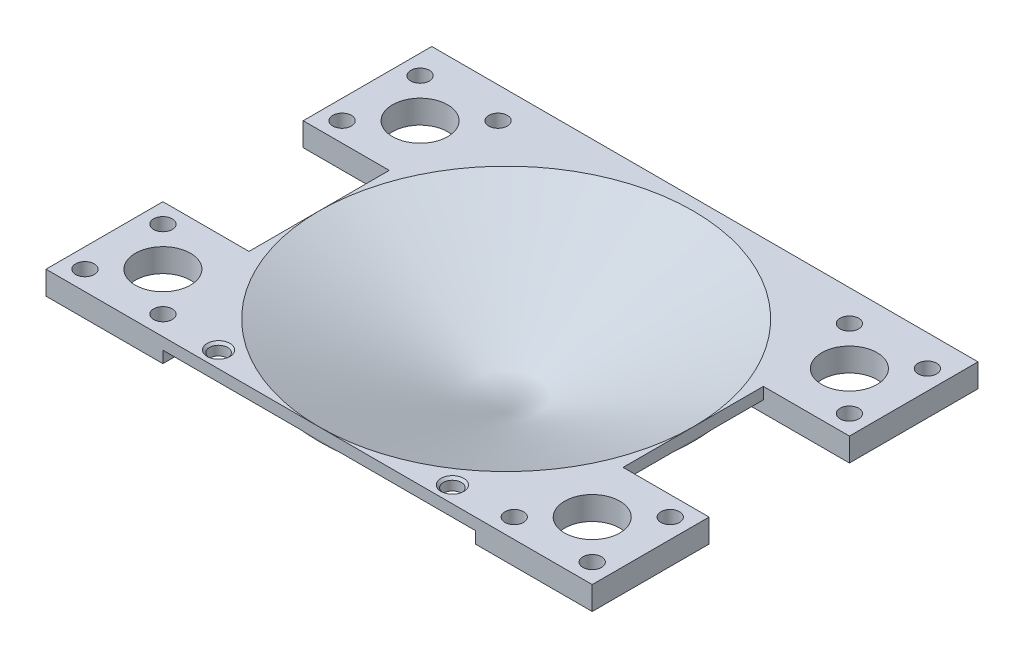
from build123d import *

# Parameters (mm, degrees)
BOSS_EXTRUDE1_START                  = -3.175
BOSS_EXTRUDE1_DEPTH                  = 3.175
SKETCH4_W                            = 31.75
SKETCH4_H                            = 31.75
SKETCH4_R                            = 7.5
BOSS_EXTRUDE2_DEPTH                  = 6.35
CUT_EXTRUDE1_REACH                   = 95.422
F_8_0_199_DIAMETER_HOLE1_D           = 5.0546
F_8_0_199_DIAMETER_HOLE1_CSINK_D     = 6.3246
F_8_0_199_DIAMETER_HOLE1_CSINK_ANGLE = 90
MIRROR4_COPY_1_SKETCH_W              = 31.75
MIRROR4_COPY_1_SKETCH_H              = 31.75
MIRROR4_COPY_1_SKETCH_R              = 7.5
MIRROR4_COPY_1_DEPTH                 = 6.35
MIRROR4_COPY_2_REACH                 = 95.422
MIRROR4_COPY_3_D                     = 5.0546
MIRROR4_COPY_3_CSINK_D               = 6.3246
MIRROR4_COPY_3_CSINK_ANGLE           = 90
BOSS_EXTRUDE5_DEPTH                  = 3.175
F_8_CLEARANCE_HOLE1_D                = 4.9149
F_8_CLEARANCE_HOLE1_CSINK_D          = 6.1849
F_8_CLEARANCE_HOLE1_CSINK_ANGLE      = 90


with BuildPart() as part:
    # Sketch1 → Revolve1 (revolve)
    with BuildSketch(Plane.XY):
        Polygon((0, -21.941501914), (-50.8, 0), (-50.8, -3.458498086), (0, -25.4), align=None)
    revolve(axis=Axis((0, -55, 0), (0, 1, 0)))

    # Sketch3 → Boss-Extrude1 (add)
    with BuildSketch(Plane(origin=(0, 0, 0), x_dir=(1, 0, 0), z_dir=(0, 1, 0)).offset(BOSS_EXTRUDE1_START)):
        with BuildLine():
            Line((-50.8, 8e-09), (-50.8, -50.8))
            Line((-50.8, -50.8), (0, -50.8))
            ThreePointArc((0, -50.8), (-35.921024487, -35.921024482), (-50.8, 8e-09))
        make_face()
        with BuildLine():
            ThreePointArc((50.8, 0), (35.921024484, -35.921024484), (0, -50.8))
            Line((0, -50.8), (50.8, -50.8))
            Line((50.8, -50.8), (50.8, 0))
        make_face()
        with BuildLine():
            Line((-50.8, 50.8), (-50.8, 8e-09))
            ThreePointArc((-50.8, 8e-09), (-35.921024463, 35.921024505), (5.1e-08, 50.8))
            Line((5.1e-08, 50.8), (-50.8, 50.8))
        make_face()
        with BuildLine():
            ThreePointArc((5.1e-08, 50.8), (35.921024502, 35.921024466), (50.8, 0))
            Line((50.8, 0), (50.8, 50.8))
            Line((50.8, 50.8), (5.1e-08, 50.8))
        make_face()
    extrude(amount=BOSS_EXTRUDE1_DEPTH)

    # Sketch4 → Boss-Extrude2 (add)
    with BuildSketch(Plane(origin=(0, 0, 0), x_dir=(1, 0, 0), z_dir=(0, 1, 0))):
        with Locations((-58.3, -34.925)):
            Rectangle(SKETCH4_W, SKETCH4_H)
        with Locations((-58.3, -34.925)):
            Circle(SKETCH4_R, mode=Mode.SUBTRACT)
    boss_extrude2 = extrude(amount=-BOSS_EXTRUDE2_DEPTH)

    # Cut-Extrude1: up to this cone (the profile starts inside it)
    cut_extrude1_end = Plane(origin=(0, 0, 0), z_dir=(0, 1, 0)).offset(-21.941500914) * Cone(2.315e-06, 390.497693855, 168.663500914, align=(Align.CENTER, Align.CENTER, Align.MIN), mode=Mode.PRIVATE)
    # Sketch4<4> → Cut-Extrude1 (cut, up to the surface)
    with BuildSketch(Plane(origin=(0, 0, 0), x_dir=(1, 0, 0), z_dir=(0, 1, 0)), mode=Mode.PRIVATE) as cut_extrude1_sk1:
        with BuildLine():
            Line((-42.425, -19.05), (-47.092860393, -19.05))
            ThreePointArc((-47.092860393, -19.05), (-44.979207057, -23.611669415), (-42.425, -27.942071774))
            Line((-42.425, -27.942071774), (-42.425, -19.05))
        make_face()
    cut_extrude1_tool1 = extrude(cut_extrude1_sk1.sketch, amount=-CUT_EXTRUDE1_REACH, mode=Mode.PRIVATE) & cut_extrude1_end
    cut_extrude1 = cut_extrude1_tool1.solids().sort_by_distance((-44.045331, 0, 22.12762))[0]
    add(cut_extrude1, mode=Mode.SUBTRACT)

    # #8 (0.199) Diameter Hole1 (through all)
    with Locations(Plane(origin=(0, -6.35, 0), x_dir=(-1, 0, 0), z_dir=(0, -1, 0))):
        with Locations((68.889150429, -24.335849571), (68.889150429, -45.514150429), (47.710849571, -45.514150429)):
            f_8_0_199_diameter_hole1 = CounterSinkHole(F_8_0_199_DIAMETER_HOLE1_D / 2, F_8_0_199_DIAMETER_HOLE1_CSINK_D / 2, counter_sink_angle=F_8_0_199_DIAMETER_HOLE1_CSINK_ANGLE)

    # Mirror3: Boss-Extrude2, Cut-Extrude1, #8 (0.199) Diameter Hole1 across plane
    add(boss_extrude2.mirror(Plane.XY))
    add(cut_extrude1.mirror(Plane.XY), mode=Mode.SUBTRACT)
    add(f_8_0_199_diameter_hole1.mirror(Plane.XY), mode=Mode.SUBTRACT)

    # Mirror4: Boss-Extrude2, Cut-Extrude1, #8 (0.199) Diameter Hole1 across plane
    add(boss_extrude2.mirror(Plane(origin=(0, 0, 0), x_dir=(0, 0, 1), z_dir=(1, 0, 0))))
    add(cut_extrude1.mirror(Plane(origin=(0, 0, 0), x_dir=(0, 0, 1), z_dir=(1, 0, 0))), mode=Mode.SUBTRACT)
    add(f_8_0_199_diameter_hole1.mirror(Plane(origin=(0, 0, 0), x_dir=(0, 0, 1), z_dir=(1, 0, 0))), mode=Mode.SUBTRACT)

    # Mirror4 copy 1 sketch → Mirror4 copy 1 (add)
    with BuildSketch(Plane(origin=(0, 0, 0), x_dir=(-1, 0, 0), z_dir=(0, 1, 0))):
        with Locations((-58.3, -34.925)):
            Rectangle(MIRROR4_COPY_1_SKETCH_W, MIRROR4_COPY_1_SKETCH_H)
        with Locations((-58.3, -34.925)):
            Circle(MIRROR4_COPY_1_SKETCH_R, mode=Mode.SUBTRACT)
    extrude(amount=-MIRROR4_COPY_1_DEPTH)

    # Mirror4 copy 2: up to this cone (the profile starts inside it)
    mirror4_copy_2_end = Plane(origin=(0, 0, 0), z_dir=(0, 1, 0)).offset(-21.941500914) * Cone(2.315e-06, 390.497693855, 168.663500914, align=(Align.CENTER, Align.CENTER, Align.MIN), mode=Mode.PRIVATE)
    # Mirror4 copy 2 sketch → Mirror4 copy 2 (cut, up to the surface)
    with BuildSketch(Plane(origin=(0, 0, 0), x_dir=(-1, 0, 0), z_dir=(0, 1, 0)), mode=Mode.PRIVATE) as mirror4_copy_2_sk1:
        with BuildLine():
            Line((-42.425, -19.05), (-47.092860393, -19.05))
            ThreePointArc((-47.092860393, -19.05), (-44.979207057, -23.611669415), (-42.425, -27.942071774))
            Line((-42.425, -27.942071774), (-42.425, -19.05))
        make_face()
    mirror4_copy_2_tool1 = extrude(mirror4_copy_2_sk1.sketch, amount=-MIRROR4_COPY_2_REACH, mode=Mode.PRIVATE) & mirror4_copy_2_end
    add(mirror4_copy_2_tool1.solids().sort_by_distance((-44.045331, 0, 22.12762))[0], mode=Mode.SUBTRACT)

    # Mirror4 copy 3 (through all)
    with Locations(Plane.XZ.offset(6.35)):
        with Locations((68.889150429, -24.335849571), (68.889150429, -45.514150429), (47.710849571, -45.514150429)):
            CounterSinkHole(MIRROR4_COPY_3_D / 2, MIRROR4_COPY_3_CSINK_D / 2, counter_sink_angle=MIRROR4_COPY_3_CSINK_ANGLE)

    # Sketch13 → Boss-Extrude5 (add)
    with BuildSketch(Plane(origin=(0, 0, -50.8), x_dir=(-1, 0, 0), z_dir=(0, 0, -1))):
        Polygon((0, 0), (-74.175, 0), (-74.175, -6.35), (-42.425, -6.35), (-42.425, -3.175), (0, -3.175), (42.425, -3.175), (42.425, -6.35), (74.175, -6.35), (74.175, 0), align=None)
    extrude(amount=BOSS_EXTRUDE5_DEPTH)

    # #8 Clearance Hole1 (through all)
    with Locations(Plane(origin=(0, 0, 0), x_dir=(1, 0, 0), z_dir=(0, 1, 0))):
        with Locations((-31.75, -46.355), (31.75, -46.355)):
            CounterSinkHole(F_8_CLEARANCE_HOLE1_D / 2, F_8_CLEARANCE_HOLE1_CSINK_D / 2, counter_sink_angle=F_8_CLEARANCE_HOLE1_CSINK_ANGLE)


solid = part.part
